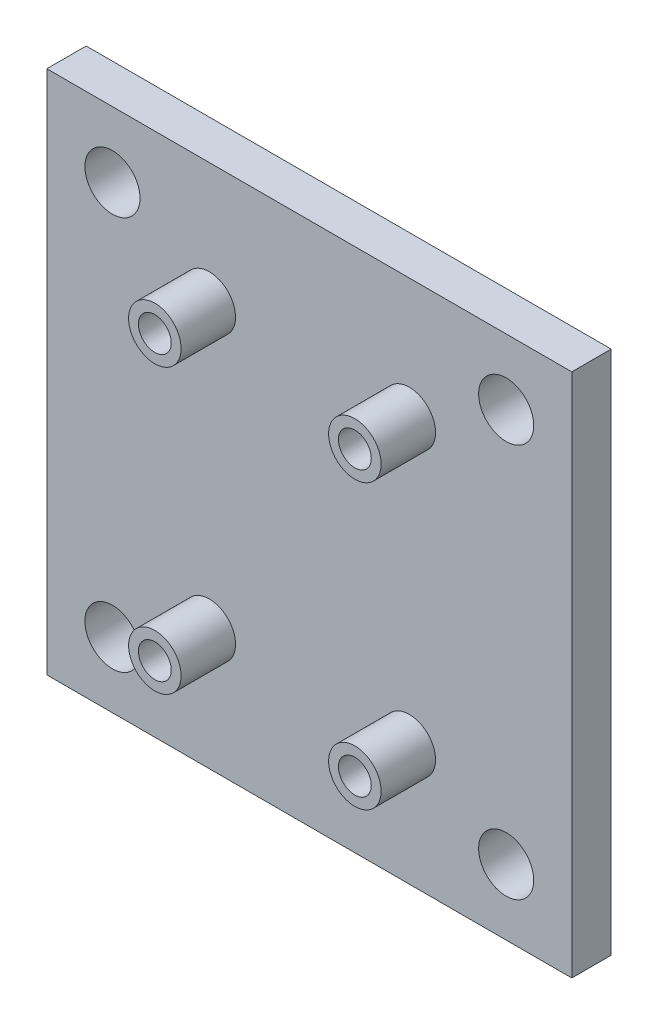
from build123d import *

# Parameters (mm, degrees)
SKETCH_1_W          = 40
SKETCH_1_H          = 40
EXTRUDE_1_DEPTH     = 3
SKETCH_2_R          = 2
EXTRUDE_2_DEPTH     = 4.15
SKETCH_4_R          = 2.1
CUT_EXTRUDE_1_DEPTH = 29.587103736
SKETCH_3_R          = 1.25
CUT_EXTRUDE_2_DEPTH = 4.15


with BuildPart() as part:
    # 草圖1 → 填料-伸長1 (new body)
    with BuildSketch(Plane.XY):
        Rectangle(SKETCH_1_W, SKETCH_1_H)
    extrude(amount=EXTRUDE_1_DEPTH)

    # 草圖2 → 填料-伸長2 (add)
    with BuildSketch(Plane.XY.offset(3)):
        with Locations((-7.62, 10.795)):
            Circle(SKETCH_2_R)
        with Locations((-7.62, -10.795)):
            Circle(SKETCH_2_R)
        with Locations((7.62, -10.795)):
            Circle(SKETCH_2_R)
        with Locations((7.62, 10.795)):
            Circle(SKETCH_2_R)
    extrude(amount=EXTRUDE_2_DEPTH)

    # 草圖4 → 除料-伸長1 (cut, through all)
    with BuildSketch(Plane.XY.offset(3)):
        with Locations((-15, 15)):
            Circle(SKETCH_4_R)
        with Locations((-15, -15)):
            Circle(SKETCH_4_R)
        with Locations((15, -15)):
            Circle(SKETCH_4_R)
        with Locations((15, 15)):
            Circle(SKETCH_4_R)
    extrude(amount=-CUT_EXTRUDE_1_DEPTH, mode=Mode.SUBTRACT)

    # 草圖3 → 除料-伸長2 (cut)
    with BuildSketch(Plane.XY.offset(7.15)):
        with Locations((-7.62, 10.795)):
            Circle(SKETCH_3_R)
        with Locations((-7.62, -10.795)):
            Circle(SKETCH_3_R)
        with Locations((7.62, -10.795)):
            Circle(SKETCH_3_R)
        with Locations((7.62, 10.795)):
            Circle(SKETCH_3_R)
    extrude(amount=-CUT_EXTRUDE_2_DEPTH, mode=Mode.SUBTRACT)


solid = part.part
